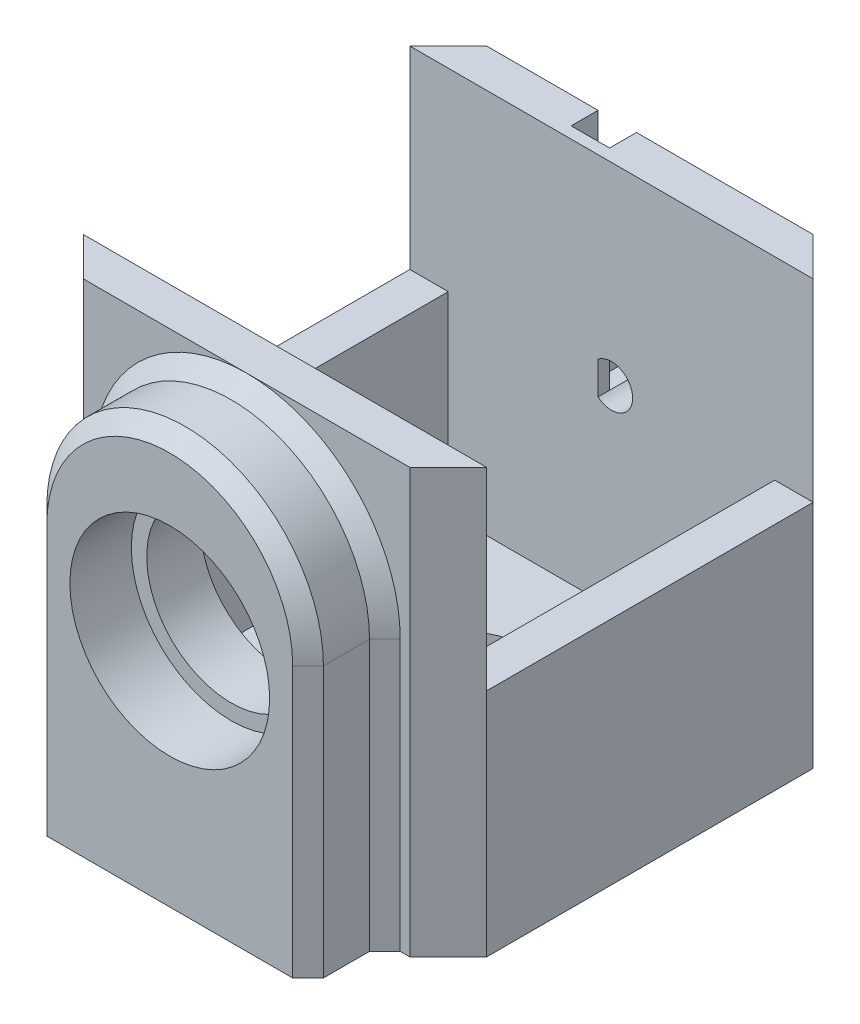
from build123d import *

# Parameters (mm, degrees)
SKETCH1_W                = 52.5
SKETCH1_H                = 52.5
SKETCH1_W_2              = 42.5
SKETCH1_H_2              = 42.5
BOSS_EXTRUDE1_DEPTH      = 60
SKETCH2_W                = 42.5
SKETCH2_H                = 42.5
BOSS_EXTRUDE2_DEPTH      = 5
CUT_EXTRUDE1_DEPTH       = 67.3560472
CUT_EXTRUDE1_DEPTH_BACK  = 67.3560472
SKETCH3_R                = 1.75
SKETCH3_R_2              = 7.5
SKETCH4_R                = 11.5
CUT_EXTRUDE2_DEPTH       = 2
SKETCH5_R                = 0.75
SKETCH5_R_2              = 3.5
BOSS_EXTRUDE3_DEPTH      = 10
CUT_EXTRUDE3_DEPTH       = 84.936359821
CUT_EXTRUDE3_DEPTH_BACK  = 84.936359821
SKETCH6_W                = 52.5
SKETCH6_H                = 16.216064207
CUT_EXTRUDE4_START       = -23
SKETCH7_R                = 3.5
SKETCH7_R_2              = 0.75
CUT_EXTRUDE4_DEPTH       = 23
CHAMFER1_SIZE            = 5
CHAMFER3_SIZE            = 2
CHAMFER4_SIZE            = 1
SKETCH8_R                = 13
BOSS_EXTRUDE4_DEPTH      = 10
SKETCH9_R                = 12
CUT_EXTRUDE5_DEPTH       = 10
CHAMFER5_SIZE            = 2
CUT_EXTRUDE6_DEPTH       = 85.677697815
CUT_EXTRUDE6_DEPTH_BACK  = 85.677697815
SKETCH10_W               = 42.5
SKETCH10_H               = 45.698966911
SKETCH11_R               = 13
CUT_EXTRUDE7_DEPTH       = 10
SKETCH12_R               = 13
BOSS_EXTRUDE6_DEPTH      = 15
BOSS_EXTRUDE7_START      = -8
SKETCH13_R               = 13
BOSS_EXTRUDE7_DEPTH      = 7
SKETCH14_R               = 11
CUT_EXTRUDE8_DEPTH       = 14
SKETCH15_W               = 68.151817742
SKETCH15_H               = 162.163599098
CUT_EXTRUDE9_DEPTH       = 34
BOSS_EXTRUDE8_REACH      = 99.7
SKETCH16_R               = 12
SKETCH16_R_2             = 2.75
BOSS_EXTRUDE9_DEPTH      = 15
CHAMFER6_SIZE            = 3
CUT_EXTRUDE10_DEPTH      = 75.854024608
CUT_EXTRUDE10_DEPTH_BACK = 75.854024608
SKETCH18_W               = 80.381770786
SKETCH18_H               = 10.493887453
SKETCH19_R               = 2.75
CUT_EXTRUDE11_DEPTH      = 5
CUT_EXTRUDE12_START      = 25
SKETCH20_W               = 5
SKETCH20_H               = 8.5
CUT_EXTRUDE12_DEPTH      = 47.056838389
CUT_EXTRUDE13_DEPTH      = 72.721766444
CUT_EXTRUDE15_START      = -10
SKETCH21_R               = 4.5
CUT_EXTRUDE15_DEPTH      = 15


with BuildPart() as part:
    # Sketch1 → Boss-Extrude1 (new body)
    with BuildSketch(Plane(origin=(0, 0, 0), x_dir=(1, 0, 0), z_dir=(0, 1, 0))):
        Rectangle(SKETCH1_W, SKETCH1_H)
        Rectangle(SKETCH1_W_2, SKETCH1_H_2, mode=Mode.SUBTRACT)
    extrude(amount=BOSS_EXTRUDE1_DEPTH)

    # Sketch2 → Boss-Extrude2 (add)
    with BuildSketch(Plane(origin=(0, 0, 0), x_dir=(1, 0, 0), z_dir=(0, 1, 0))):
        Rectangle(SKETCH2_W, SKETCH2_H)
    extrude(amount=BOSS_EXTRUDE2_DEPTH)

    # Sketch3 → Cut-Extrude1 (cut, two sides: drawn at the far end of the back side and taken through both)
    with BuildSketch(Plane(origin=(0, 5, 0), x_dir=(1, 0, 0), z_dir=(0, 1, 0)).offset(-CUT_EXTRUDE1_DEPTH_BACK)):
        with Locations(Location((-15.5, 15.5, 0), (0, 0, 270))):
            Circle(SKETCH3_R)
        with Locations(Location((-15.5, -15.5, 0), (0, 0, 270))):
            Circle(SKETCH3_R)
        with Locations(Location((15.5, 15.5, 0), (0, 0, 270))):
            Circle(SKETCH3_R)
        with Locations(Location((15.5, -15.5, 0), (0, 0, 270))):
            Circle(SKETCH3_R)
        with Locations(Location((0, 0, 0), (0, 0, 270))):
            Circle(SKETCH3_R_2)
    extrude(amount=CUT_EXTRUDE1_DEPTH + CUT_EXTRUDE1_DEPTH_BACK, mode=Mode.SUBTRACT)

    # Sketch4 → Cut-Extrude2 (cut)
    with BuildSketch(Plane(origin=(0, 5, 0), x_dir=(1, 0, 0), z_dir=(0, 1, 0))):
        with Locations(Location((0, 0, 0), (0, 0, 270))):
            Circle(SKETCH4_R)
    extrude(amount=-CUT_EXTRUDE2_DEPTH, mode=Mode.SUBTRACT)

    # Sketch5 → Boss-Extrude3 (add)
    with BuildSketch(Plane(origin=(0, 0, -26.25), x_dir=(-1, 0, 0), z_dir=(0, 0, -1))):
        with BuildLine():
            Line((10, 30), (10, -2.899053056))
            ThreePointArc((10, -2.899053056), (0, -12.899053056), (-10, -2.899053056))
            Line((-10, -2.899053056), (-10, 30))
            ThreePointArc((-10, 30), (0, 40), (10, 30))
        make_face()
        with Locations((-4, 37)):
            Circle(SKETCH5_R, mode=Mode.SUBTRACT)
        with Locations((0, 37)):
            Circle(SKETCH5_R, mode=Mode.SUBTRACT)
        with Locations((4, 37)):
            Circle(SKETCH5_R, mode=Mode.SUBTRACT)
        with Locations((-7, 34)):
            Circle(SKETCH5_R, mode=Mode.SUBTRACT)
        with Locations((-7, 30)):
            Circle(SKETCH5_R, mode=Mode.SUBTRACT)
        with Locations((-7, 26)):
            Circle(SKETCH5_R, mode=Mode.SUBTRACT)
        with Locations((-4, 23)):
            Circle(SKETCH5_R, mode=Mode.SUBTRACT)
        with Locations((0, 23)):
            Circle(SKETCH5_R, mode=Mode.SUBTRACT)
        with Locations((4, 23)):
            Circle(SKETCH5_R, mode=Mode.SUBTRACT)
        with Locations((7, 26)):
            Circle(SKETCH5_R, mode=Mode.SUBTRACT)
        with Locations((7, 30)):
            Circle(SKETCH5_R, mode=Mode.SUBTRACT)
        with Locations((7, 34)):
            Circle(SKETCH5_R, mode=Mode.SUBTRACT)
        with Locations((0, 30)):
            Circle(SKETCH5_R_2, mode=Mode.SUBTRACT)
    extrude(amount=BOSS_EXTRUDE3_DEPTH)

    # Sketch6 → Cut-Extrude3 (cut, two sides: drawn at the far end of the back side and taken through both)
    with BuildSketch(Plane(origin=(0, 0, -26.25), x_dir=(-1, 0, 0), z_dir=(0, 0, -1)).offset(-CUT_EXTRUDE3_DEPTH_BACK)):
        with Locations((0, -8.108032104)):
            Rectangle(SKETCH6_W, SKETCH6_H)
    extrude(amount=CUT_EXTRUDE3_DEPTH + CUT_EXTRUDE3_DEPTH_BACK, mode=Mode.SUBTRACT)

    # Sketch7 → Cut-Extrude4 (cut)
    with BuildSketch(Plane(origin=(0, 0, -26.25), x_dir=(-1, 0, 0), z_dir=(0, 0, -1)).offset(CUT_EXTRUDE4_START)):
        with Locations(Location((0, 30, 0), (0, 0, 180))):
            Circle(SKETCH7_R)
        with Locations(Location((-4, 37, 0), (0, 0, 180))):
            Circle(SKETCH7_R_2)
        with Locations(Location((0, 37, 0), (0, 0, 180))):
            Circle(SKETCH7_R_2)
        with Locations(Location((4, 37, 0), (0, 0, 180))):
            Circle(SKETCH7_R_2)
        with Locations(Location((7, 34, 0), (0, 0, 180))):
            Circle(SKETCH7_R_2)
        with Locations(Location((7, 30, 0), (0, 0, 180))):
            Circle(SKETCH7_R_2)
        with Locations(Location((7, 26, 0), (0, 0, 180))):
            Circle(SKETCH7_R_2)
        with Locations(Location((4, 23, 0), (0, 0, 180))):
            Circle(SKETCH7_R_2)
        with Locations(Location((0, 23, 0), (0, 0, 180))):
            Circle(SKETCH7_R_2)
        with Locations(Location((-4, 23, 0), (0, 0, 180))):
            Circle(SKETCH7_R_2)
        with Locations(Location((-7, 26, 0), (0, 0, 180))):
            Circle(SKETCH7_R_2)
        with Locations(Location((-7, 30, 0), (0, 0, 180))):
            Circle(SKETCH7_R_2)
        with Locations(Location((-7, 34, 0), (0, 0, 180))):
            Circle(SKETCH7_R_2)
    extrude(amount=CUT_EXTRUDE4_DEPTH, mode=Mode.SUBTRACT)

    # Chamfer1
    # the kernel refuses this chamfer: 5 mm, written as the material it takes off along each edge
    with BuildSketch(Plane(origin=(26.25, -12.85841494, 26.25), x_dir=(-0.9996219169112968, 0, 0.027495876610586317), z_dir=(0, 1, 0)), Plane(origin=(-26.25, -12.85841494, 26.25), x_dir=(-0.027495876610586317, 0, -0.9996219169112968), z_dir=(0, 1, 0))) as chamfer1_piece_1:
        Polygon((CHAMFER1_SIZE * 0.999621916911, -CHAMFER1_SIZE * 0.0274958766106), (-CHAMFER1_SIZE * 0.0274958766106, -CHAMFER1_SIZE * 0.999621916911), (0, 0), align=None)
    extrude(amount=85.71682988, mode=Mode.SUBTRACT)
    with BuildSketch(Plane(origin=(26.25, -12.85841494, -26.25), x_dir=(-0.9996219169112968, 0, -0.027495876610586317), z_dir=(0, 1, 0)), Plane(origin=(-26.25, -12.85841494, -26.25), x_dir=(-0.027495876610586317, 0, 0.9996219169112968), z_dir=(0, 1, 0))) as chamfer1_piece_2:
        Polygon((CHAMFER1_SIZE * 0.999621916911, CHAMFER1_SIZE * 0.0274958766106), (-CHAMFER1_SIZE * 0.0274958766106, CHAMFER1_SIZE * 0.999621916911), (0, 0), align=None)
    extrude(amount=85.71682988, mode=Mode.SUBTRACT)
    with BuildSketch(Plane(origin=(-10, 30, -36.25), x_dir=(-0.027495876610586317, 0, 0.9996219169112968), z_dir=(0, -1, 0)), Plane(origin=(10, -12.85841494, -36.25), x_dir=(0.027495876610586317, 0, 0.9996219169112968), z_dir=(0, 1, 0))) as chamfer1_piece_3:
        Polygon((CHAMFER1_SIZE * 0.999621916911, -CHAMFER1_SIZE * 0.0274958766106), (-CHAMFER1_SIZE * 0.0274958766106, -CHAMFER1_SIZE * 0.999621916911), (0, 0), align=None)
    extrude(amount=42.85841494, mode=Mode.SUBTRACT)
    with BuildSketch(Plane(origin=(0, 30, -36.25), x_dir=(1, 0, 0), z_dir=(0, -1, 0))) as chamfer1_piece_4:
        Polygon((10, CHAMFER1_SIZE), (10 - CHAMFER1_SIZE, 0), (10, 0), align=None)
    revolve(axis=Axis((0, 30, -36.25), (0, 0, 1)), revolution_arc=180, mode=Mode.SUBTRACT)

    # Chamfer3
    chamfer3_edges = [part.edges().sort_by_distance(p)[0] for p in [
        (21.25, 60, 0),
        (0, 60, -21.25),
        (-21.25, 60, 0),
        (0, 60, 21.25),
    ]]
    chamfer(chamfer3_edges, length=CHAMFER3_SIZE)

    # Chamfer4
    chamfer4_edges = [part.edges().sort_by_distance(p)[0] for p in [
        (-3.5, 30, -21.25),
        (3.5, 30, -36.25),
    ]]
    chamfer(chamfer4_edges, length=CHAMFER4_SIZE)

    # Sketch8 → Boss-Extrude4 (add)
    with BuildSketch(Plane.XY.offset(26.25)):
        with BuildLine():
            Line((18, 35.190119423), (18, 0))
            Line((18, 0), (-18, 0))
            Line((-18, 0), (-18, 35.190119423))
            ThreePointArc((-18, 35.190119423), (0, 53.190119423), (18, 35.190119423))
        make_face()
        with Locations((0, 35.190119423)):
            Circle(SKETCH8_R, mode=Mode.SUBTRACT)
    extrude(amount=BOSS_EXTRUDE4_DEPTH)

    # Sketch9 → Cut-Extrude5 (cut)
    with BuildSketch(Plane.XY.offset(26.25)):
        with Locations((0, 35.190119423)):
            Circle(SKETCH9_R)
    extrude(amount=-CUT_EXTRUDE5_DEPTH, mode=Mode.SUBTRACT)

    # Chamfer5
    chamfer5_edges = [part.edges().sort_by_distance(p)[0] for p in [
        (0, 53.190119423, 36.25),
        (-18, 17.595059711, 36.25),
        (18, 17.595059711, 36.25),
        (0, 53.190119423, 26.25),
        (-18, 17.595059711, 26.25),
        (18, 17.595059711, 26.25),
    ]]
    chamfer(chamfer5_edges, length=CHAMFER5_SIZE)

    # Sketch10 → Cut-Extrude6 (cut, two sides: drawn at the far end of the back side and taken through both)
    with BuildSketch(Plane(origin=(-21.25, 0, 0), x_dir=(0, 0, -1), z_dir=(1, 0, 0)).offset(-CUT_EXTRUDE6_DEPTH_BACK)):
        with Locations((0, 52.849483455)):
            Rectangle(SKETCH10_W, SKETCH10_H)
    extrude(amount=CUT_EXTRUDE6_DEPTH + CUT_EXTRUDE6_DEPTH_BACK, mode=Mode.SUBTRACT)

    # Sketch11 → Cut-Extrude7 (cut)
    with BuildSketch(Plane.XY.offset(36.25)):
        with Locations((0, 30)):
            Circle(SKETCH11_R)
    extrude(amount=-CUT_EXTRUDE7_DEPTH, mode=Mode.SUBTRACT)

    # Sketch12 → Boss-Extrude6 (add)
    with BuildSketch(Plane.XY.offset(36.25)):
        with BuildLine():
            Line((13.742429917, 37), (13.742429917, 8.778772007))
            ThreePointArc((13.742429917, 8.778772007), (0, -4.96365791), (-13.742429917, 8.778772007))
            Line((-13.742429917, 8.778772007), (-13.742429917, 37))
            ThreePointArc((-13.742429917, 37), (0, 50.742429917), (13.742429917, 37))
        make_face()
        with Locations((0, 30)):
            Circle(SKETCH12_R, mode=Mode.SUBTRACT)
    extrude(amount=-BOSS_EXTRUDE6_DEPTH)

    # Sketch13 → Boss-Extrude7 (add)
    with BuildSketch(Plane.XY.offset(36.25).offset(BOSS_EXTRUDE7_START)):
        with Locations((0, 30)):
            Circle(SKETCH13_R)
    extrude(amount=-BOSS_EXTRUDE7_DEPTH)

    # Sketch14 → Cut-Extrude8 (cut)
    with BuildSketch(Plane.XY.offset(28.25)):
        with Locations((0, 30)):
            Circle(SKETCH14_R)
    extrude(amount=-CUT_EXTRUDE8_DEPTH, mode=Mode.SUBTRACT)

    # Sketch15 → Cut-Extrude9 (cut)
    with BuildSketch(Plane.XZ):
        Rectangle(SKETCH15_W, SKETCH15_H)
    extrude(amount=CUT_EXTRUDE9_DEPTH, mode=Mode.SUBTRACT)

    # Boss-Extrude8: up to this face of the body (flat: up to its plane)
    boss_extrude8_end = Plane(part.part.faces().sort_by_distance((23.75, 30.760345316, -21.25))[0])
    # Sketch16 → Boss-Extrude8 (add, up to the picked face)
    with BuildSketch(Plane(origin=(0, 0, -36.25), x_dir=(-1, 0, 0), z_dir=(0, 0, -1)), mode=Mode.PRIVATE) as boss_extrude8_sk1:
        with Locations((0, 30)):
            Circle(SKETCH16_R)
        with Locations((0, 30)):
            Circle(SKETCH16_R_2, mode=Mode.SUBTRACT)
    boss_extrude8_tool1 = split(extrude(boss_extrude8_sk1.sketch, amount=-BOSS_EXTRUDE8_REACH, mode=Mode.PRIVATE), bisect_by=boss_extrude8_end, keep=Keep.BOTH, mode=Mode.PRIVATE)
    add(boss_extrude8_tool1.solids().sort_by(Axis((11.660589, 30, -36.25), (0, 0, 1)))[0])

    # Sketch17 → Boss-Extrude9 (add)
    with BuildSketch(Plane(origin=(0, 0, -36.25), x_dir=(-1, 0, 0), z_dir=(0, 0, -1))):
        with BuildLine():
            Line((1.75, 32.121320344), (1.75, 27.878679656))
            ThreePointArc((1.75, 27.878679656), (2.75, 30), (1.75, 32.121320344))
        make_face()
    extrude(amount=-BOSS_EXTRUDE9_DEPTH)

    # Chamfer6
    chamfer6_edges = [part.edges().sort_by_distance(p)[0] for p in [
        (0, 42, -36.25),
    ]]
    chamfer(chamfer6_edges, length=CHAMFER6_SIZE)

    # Sketch18 → Cut-Extrude10 (cut, two sides: drawn at the far end of the back side and taken through both)
    with BuildSketch(Plane(origin=(0, 0, 0), x_dir=(0, 0, -1), z_dir=(1, 0, 0)).offset(-CUT_EXTRUDE10_DEPTH_BACK)):
        with Locations((0, 60.43706315)):
            Rectangle(SKETCH18_W, SKETCH18_H)
    extrude(amount=CUT_EXTRUDE10_DEPTH + CUT_EXTRUDE10_DEPTH_BACK, mode=Mode.SUBTRACT)

    # Sketch19 → Cut-Extrude11 (cut)
    with BuildSketch(Plane(origin=(-1.75, 0, 0), x_dir=(0, 0, -1), z_dir=(1, 0, 0))):
        Polygon((31.25, 34.907477288), (27, 32.453738644), (27, 27.546261356), (31.25, 25.092522712), (35.5, 27.546261356), (35.5, 32.453738644), align=None)
        with Locations(Location((31.25, 30, 0), (0, 0, 90))):
            Circle(SKETCH19_R, mode=Mode.SUBTRACT)
    extrude(amount=-CUT_EXTRUDE11_DEPTH, mode=Mode.SUBTRACT)

    # Sketch20 → Cut-Extrude12 (cut, through all)
    with BuildSketch(Plane(origin=(0, 0, 0), x_dir=(1, 0, 0), z_dir=(0, 1, 0)).offset(CUT_EXTRUDE12_START)):
        with Locations((-4.25, 27)):
            Rectangle(SKETCH20_W, SKETCH20_H)
    extrude(amount=CUT_EXTRUDE12_DEPTH, mode=Mode.SUBTRACT)

    # Sketch19<2> → Cut-Extrude13 (cut, through all)
    with BuildSketch(Plane(origin=(-1.75, 0, 0), x_dir=(0, 0, -1), z_dir=(1, 0, 0))):
        with BuildLine():
            Line((33, 32.121320344), (29.5, 32.121320344))
            ThreePointArc((29.5, 32.121320344), (28.5, 30), (29.5, 27.878679656))
            Line((29.5, 27.878679656), (33, 27.878679656))
            ThreePointArc((33, 27.878679656), (33.737468593, 28.82739606), (34, 30))
            ThreePointArc((34, 30), (33.737468593, 31.17260394), (33, 32.121320344))
        make_face()
        with BuildLine():
            ThreePointArc((33, 32.121320344), (31.25, 32.75), (29.5, 32.121320344))
            Line((29.5, 32.121320344), (33, 32.121320344))
        make_face()
        with BuildLine():
            Line((33, 27.878679656), (29.5, 27.878679656))
            ThreePointArc((29.5, 27.878679656), (31.25, 27.25), (33, 27.878679656))
        make_face()
    extrude(amount=-CUT_EXTRUDE13_DEPTH, mode=Mode.SUBTRACT)

    # Sketch21 → Cut-Extrude15 (cut)
    with BuildSketch(Plane(origin=(0, 0, 0), x_dir=(0, 0, -1), z_dir=(1, 0, 0)).offset(CUT_EXTRUDE15_START)):
        with Locations((31.25, 30)):
            Circle(SKETCH21_R)
    extrude(amount=-CUT_EXTRUDE15_DEPTH, mode=Mode.SUBTRACT)


solid = part.part
